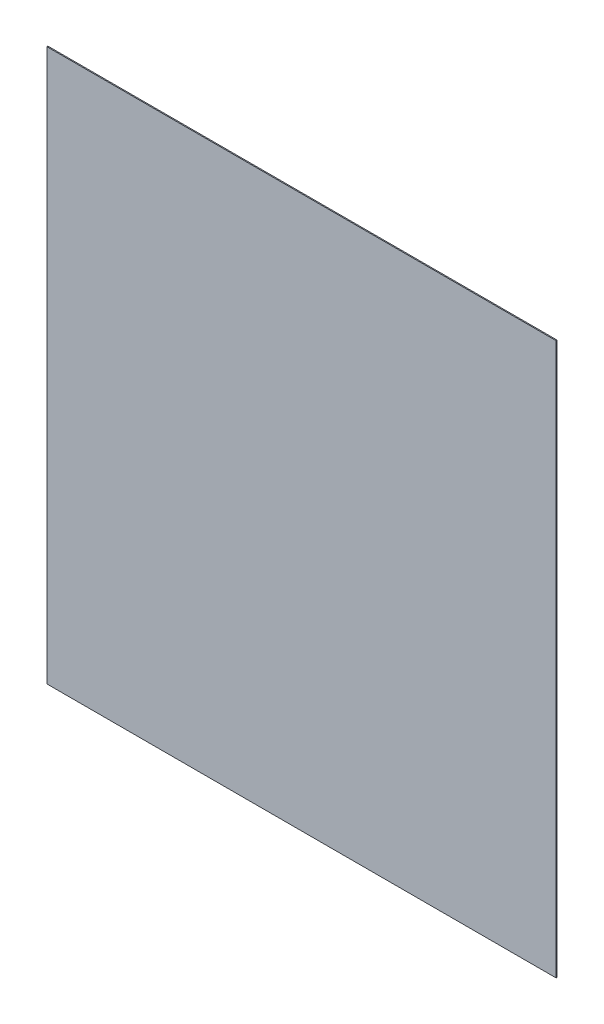
from build123d import *

# Parameters (mm, degrees)
SKETCH1_W          = 600
SKETCH1_H          = 650
BASE_FLANGE1_DEPTH = 1.2


# Sheet-metal steps are written as plain solids
with BuildPart() as part:
    # Sketch1 → Base-Flange1 (new body)
    with BuildSketch(Plane.XY):
        Rectangle(SKETCH1_W, SKETCH1_H)
    extrude(amount=-BASE_FLANGE1_DEPTH)


solid = part.part
